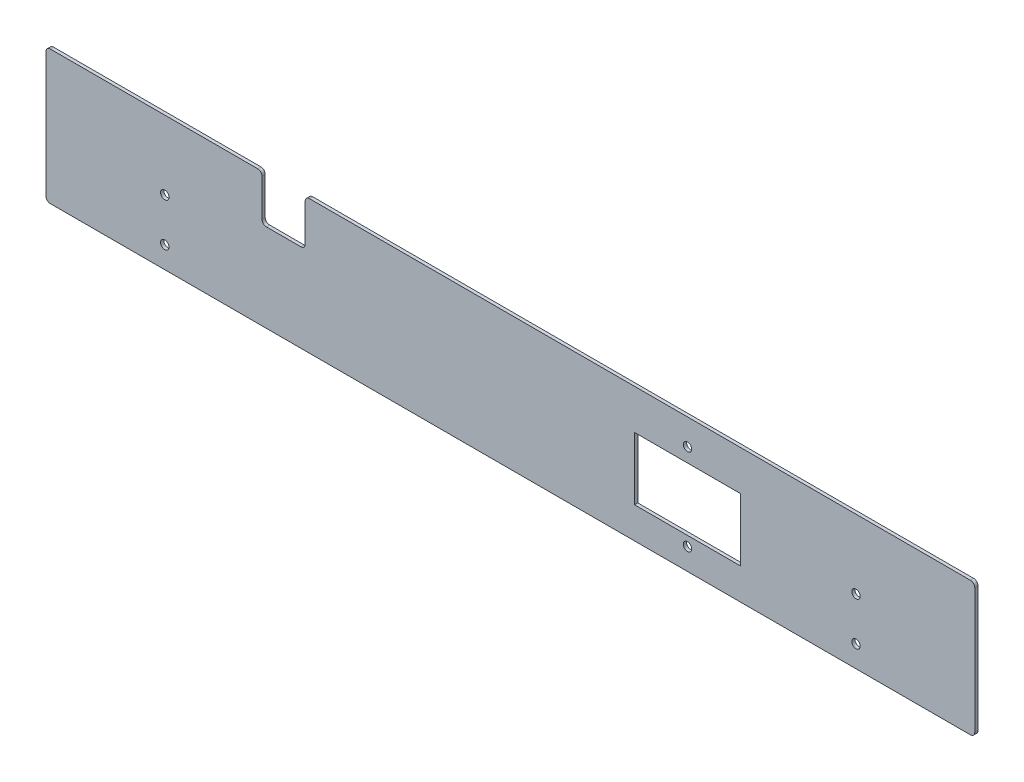
from build123d import *

# Parameters (mm, degrees)
SKETCH1_R           = 1.95
SKETCH1_W           = 49
SKETCH1_H           = 29
BOSS_EXTRUDE1_DEPTH = 1.5
FILLET1_R           = 2
SKETCH3_R           = 1.95
CUT_EXTRUDE1_DEPTH  = 10


with BuildPart() as part:
    # Sketch1 → Boss-Extrude1 (new body)
    with BuildSketch(Plane.XY):
        Polygon((-231.924811832, 29.703517588), (78.075188168, 29.703517588), (78.075188168, -32.296482412), (-351.924811832, -32.296482412), (-351.924811832, 29.703517588), (-251.924811832, 29.703517588), (-251.924811832, 8.412748494), (-231.924811832, 8.412748494), align=None)
        with Locations((-54.924811832, 17.703517588)):
            Circle(SKETCH1_R, mode=Mode.SUBTRACT)
        with Locations((-54.924811832, -22.296482412)):
            Circle(SKETCH1_R, mode=Mode.SUBTRACT)
        with Locations((-54.924811832, -3.296482412)):
            Rectangle(SKETCH1_W, SKETCH1_H, mode=Mode.SUBTRACT)
    extrude(amount=BOSS_EXTRUDE1_DEPTH)

    # Fillet1
    fillet1_edges = [part.edges().sort_by_distance(p)[0] for p in [
        (78.075188168, -32.296482412, 0.75),
        (-351.924811832, -32.296482412, 0.75),
        (-351.924811832, 29.703517588, 0.75),
        (-231.924811832, 8.412748494, 0.75),
        (-251.924811832, 8.412748494, 0.75),
        (-251.924811832, 29.703517588, 0.75),
        (-231.924811832, 29.703517588, 0.75),
        (78.075188168, 29.703517588, 0.75),
    ]]
    fillet(fillet1_edges, radius=FILLET1_R)

    # Sketch3 → Cut-Extrude1 (cut)
    with BuildSketch(Plane(origin=(0, 0, 0), x_dir=(-1, 0, 0), z_dir=(0, 0, -1))):
        with Locations((-23.075188168, -22.296482412)):
            Circle(SKETCH3_R)
        with Locations((-23.075188168, -2.296482412)):
            Circle(SKETCH3_R)
        with Locations((296.924811832, -22.296482412)):
            Circle(SKETCH3_R)
        with Locations((296.924811832, -2.296482412)):
            Circle(SKETCH3_R)
    extrude(amount=-CUT_EXTRUDE1_DEPTH, mode=Mode.SUBTRACT)


solid = part.part
